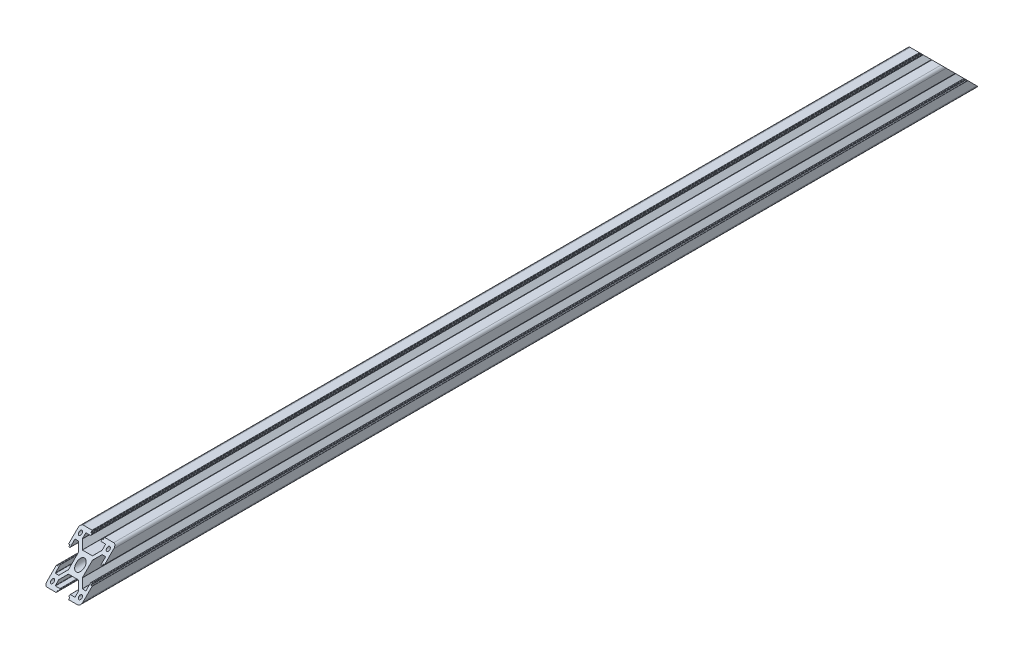
from build123d import *

# Parameters (mm, degrees)
CROQUIS1_R              = 1.25
CROQUIS1_R_2            = 3.4
SALIENTE_EXTRUIR1_DEPTH = 750
CUT_EXTRUDE1_DEPTH      = 751.299940024
CUT_EXTRUDE1_DEPTH_BACK = 751.299940024


with BuildPart() as part:
    # Croquis1 → Saliente-Extruir1 (new body)
    with BuildSketch(Plane.XY):
        with BuildLine():
            Line((-4.161522369, 5.8), (4.161522369, 5.8))
            ThreePointArc((4.161522369, 5.8), (4.238059055, 5.815224093), (4.302943725, 5.858578644))
            Line((4.302943725, 5.858578644), (8.191421356, 9.747056275))
            ThreePointArc((8.191421356, 9.747056275), (8.234775907, 9.811940945), (8.25, 9.888477631))
            Line((8.25, 9.888477631), (8.25, 12.6))
            ThreePointArc((8.25, 12.6), (8.191421356, 12.741421356), (8.05, 12.8))
            Line((8.05, 12.8), (4.3, 12.8))
            ThreePointArc((4.3, 12.8), (4.158578644, 12.858578644), (4.1, 13))
            Line((4.1, 13), (4.1, 13.7))
            ThreePointArc((4.1, 13.7), (4.158578644, 13.841421356), (4.3, 13.9))
            Line((4.3, 13.9), (4.9, 13.9))
            ThreePointArc((4.9, 13.9), (5.041421356, 13.958578644), (5.1, 14.1))
            Line((5.1, 14.1), (5.1, 14.8))
            ThreePointArc((5.1, 14.8), (5.158578644, 14.941421356), (5.3, 15))
            Line((5.3, 15), (12.8, 15))
            ThreePointArc((12.8, 15), (14.355634919, 14.355634919), (15, 12.8))
            Line((15, 12.8), (15, 5.3))
            ThreePointArc((15, 5.3), (14.941421356, 5.158578644), (14.8, 5.1))
            Line((14.8, 5.1), (13.9, 5.1))
            Line((13.9, 5.1), (13.9, 4.3))
            ThreePointArc((13.9, 4.3), (13.841421356, 4.158578644), (13.7, 4.1))
            Line((13.7, 4.1), (13, 4.1))
            ThreePointArc((13, 4.1), (12.858578644, 4.158578644), (12.8, 4.3))
            Line((12.8, 4.3), (12.8, 8.05))
            ThreePointArc((12.8, 8.05), (12.741421356, 8.191421356), (12.6, 8.25))
            Line((12.6, 8.25), (9.888477631, 8.25))
            ThreePointArc((9.888477631, 8.25), (9.811940945, 8.234775907), (9.747056275, 8.191421356))
            Line((9.747056275, 8.191421356), (5.858578644, 4.302943725))
            ThreePointArc((5.858578644, 4.302943725), (5.815224093, 4.238059055), (5.8, 4.161522369))
            Line((5.8, 4.161522369), (5.8, -4.161522369))
            ThreePointArc((5.8, -4.161522369), (5.815224093, -4.238059055), (5.858578644, -4.302943725))
            Line((5.858578644, -4.302943725), (9.747056275, -8.191421356))
            ThreePointArc((9.747056275, -8.191421356), (9.811940945, -8.234775907), (9.888477631, -8.25))
            Line((9.888477631, -8.25), (12.6, -8.25))
            ThreePointArc((12.6, -8.25), (12.741421356, -8.191421356), (12.8, -8.05))
            Line((12.8, -8.05), (12.8, -4.3))
            ThreePointArc((12.8, -4.3), (12.858578644, -4.158578644), (13, -4.1))
            Line((13, -4.1), (13.7, -4.1))
            ThreePointArc((13.7, -4.1), (13.841421356, -4.158578644), (13.9, -4.3))
            Line((13.9, -4.3), (13.9, -5.1))
            Line((13.9, -5.1), (14.8, -5.1))
            ThreePointArc((14.8, -5.1), (14.941421356, -5.158578644), (15, -5.3))
            Line((15, -5.3), (15, -12.8))
            ThreePointArc((15, -12.8), (14.355634919, -14.355634919), (12.8, -15))
            Line((12.8, -15), (5.3, -15))
            ThreePointArc((5.3, -15), (5.158578644, -14.941421356), (5.1, -14.8))
            Line((5.1, -14.8), (5.1, -14.1))
            ThreePointArc((5.1, -14.1), (5.041421356, -13.958578644), (4.9, -13.9))
            Line((4.9, -13.9), (4.3, -13.9))
            ThreePointArc((4.3, -13.9), (4.158578644, -13.841421356), (4.1, -13.7))
            Line((4.1, -13.7), (4.1, -13))
            ThreePointArc((4.1, -13), (4.158578644, -12.858578644), (4.3, -12.8))
            Line((4.3, -12.8), (8.05, -12.8))
            ThreePointArc((8.05, -12.8), (8.191421356, -12.741421356), (8.25, -12.6))
            Line((8.25, -12.6), (8.25, -9.888477631))
            ThreePointArc((8.25, -9.888477631), (8.234775907, -9.811940945), (8.191421356, -9.747056275))
            Line((8.191421356, -9.747056275), (4.302943725, -5.858578644))
            ThreePointArc((4.302943725, -5.858578644), (4.238059055, -5.815224093), (4.161522369, -5.8))
            Line((4.161522369, -5.8), (-4.161522369, -5.8))
            ThreePointArc((-4.161522369, -5.8), (-4.238059055, -5.815224093), (-4.302943725, -5.858578644))
            Line((-4.302943725, -5.858578644), (-8.191421356, -9.747056275))
            ThreePointArc((-8.191421356, -9.747056275), (-8.234775907, -9.811940945), (-8.25, -9.888477631))
            Line((-8.25, -9.888477631), (-8.25, -12.6))
            ThreePointArc((-8.25, -12.6), (-8.191421356, -12.741421356), (-8.05, -12.8))
            Line((-8.05, -12.8), (-4.3, -12.8))
            ThreePointArc((-4.3, -12.8), (-4.158578644, -12.858578644), (-4.1, -13))
            Line((-4.1, -13), (-4.1, -13.7))
            ThreePointArc((-4.1, -13.7), (-4.158578644, -13.841421356), (-4.3, -13.9))
            Line((-4.3, -13.9), (-4.9, -13.9))
            ThreePointArc((-4.9, -13.9), (-5.041421356, -13.958578644), (-5.1, -14.1))
            Line((-5.1, -14.1), (-5.1, -14.8))
            ThreePointArc((-5.1, -14.8), (-5.158578644, -14.941421356), (-5.3, -15))
            Line((-5.3, -15), (-12.8, -15))
            ThreePointArc((-12.8, -15), (-14.355634919, -14.355634919), (-15, -12.8))
            Line((-15, -12.8), (-15, -5.3))
            ThreePointArc((-15, -5.3), (-14.941421356, -5.158578644), (-14.8, -5.1))
            Line((-14.8, -5.1), (-13.9, -5.1))
            Line((-13.9, -5.1), (-13.9, -4.3))
            ThreePointArc((-13.9, -4.3), (-13.841421356, -4.158578644), (-13.7, -4.1))
            Line((-13.7, -4.1), (-13, -4.1))
            ThreePointArc((-13, -4.1), (-12.858578644, -4.158578644), (-12.8, -4.3))
            Line((-12.8, -4.3), (-12.8, -8.05))
            ThreePointArc((-12.8, -8.05), (-12.741421356, -8.191421356), (-12.6, -8.25))
            Line((-12.6, -8.25), (-9.888477631, -8.25))
            ThreePointArc((-9.888477631, -8.25), (-9.811940945, -8.234775907), (-9.747056275, -8.191421356))
            Line((-9.747056275, -8.191421356), (-5.858578644, -4.302943725))
            ThreePointArc((-5.858578644, -4.302943725), (-5.815224093, -4.238059055), (-5.8, -4.161522369))
            Line((-5.8, -4.161522369), (-5.8, 4.161522369))
            ThreePointArc((-5.8, 4.161522369), (-5.815224093, 4.238059055), (-5.858578644, 4.302943725))
            Line((-5.858578644, 4.302943725), (-9.747056275, 8.191421356))
            ThreePointArc((-9.747056275, 8.191421356), (-9.811940945, 8.234775907), (-9.888477631, 8.25))
            Line((-9.888477631, 8.25), (-12.6, 8.25))
            ThreePointArc((-12.6, 8.25), (-12.741421356, 8.191421356), (-12.8, 8.05))
            Line((-12.8, 8.05), (-12.8, 4.3))
            ThreePointArc((-12.8, 4.3), (-12.858578644, 4.158578644), (-13, 4.1))
            Line((-13, 4.1), (-13.7, 4.1))
            ThreePointArc((-13.7, 4.1), (-13.841421356, 4.158578644), (-13.9, 4.3))
            Line((-13.9, 4.3), (-13.9, 5.1))
            Line((-13.9, 5.1), (-14.8, 5.1))
            ThreePointArc((-14.8, 5.1), (-14.941421356, 5.158578644), (-15, 5.3))
            Line((-15, 5.3), (-15, 12.8))
            ThreePointArc((-15, 12.8), (-14.355634919, 14.355634919), (-12.8, 15))
            Line((-12.8, 15), (-5.3, 15))
            ThreePointArc((-5.3, 15), (-5.158578644, 14.941421356), (-5.1, 14.8))
            Line((-5.1, 14.8), (-5.1, 14.1))
            ThreePointArc((-5.1, 14.1), (-5.041421356, 13.958578644), (-4.9, 13.9))
            Line((-4.9, 13.9), (-4.3, 13.9))
            ThreePointArc((-4.3, 13.9), (-4.158578644, 13.841421356), (-4.1, 13.7))
            Line((-4.1, 13.7), (-4.1, 13))
            ThreePointArc((-4.1, 13), (-4.158578644, 12.858578644), (-4.3, 12.8))
            Line((-4.3, 12.8), (-8.05, 12.8))
            ThreePointArc((-8.05, 12.8), (-8.191421356, 12.741421356), (-8.25, 12.6))
            Line((-8.25, 12.6), (-8.25, 9.888477631))
            ThreePointArc((-8.25, 9.888477631), (-8.234775907, 9.811940945), (-8.191421356, 9.747056275))
            Line((-8.191421356, 9.747056275), (-4.302943725, 5.858578644))
            ThreePointArc((-4.302943725, 5.858578644), (-4.238059055, 5.815224093), (-4.161522369, 5.8))
        make_face()
        with Locations((11.625, 11.625)):
            Circle(CROQUIS1_R, mode=Mode.SUBTRACT)
        with Locations((11.625, -11.625)):
            Circle(CROQUIS1_R, mode=Mode.SUBTRACT)
        with Locations((-11.625, -11.625)):
            Circle(CROQUIS1_R, mode=Mode.SUBTRACT)
        with Locations((-11.625, 11.625)):
            Circle(CROQUIS1_R, mode=Mode.SUBTRACT)
        Circle(CROQUIS1_R_2, mode=Mode.SUBTRACT)
    extrude(amount=SALIENTE_EXTRUIR1_DEPTH)

    # Sketch1 → Cut-Extrude1 (cut, two sides: drawn at the far end of the back side and taken through both)
    with BuildSketch(Plane(origin=(0, 0, 0), x_dir=(0, 0, -1), z_dir=(1, 0, 0)).offset(-CUT_EXTRUDE1_DEPTH_BACK)):
        Polygon((-750, -15), (-720, 15), (-750, 15), align=None)
        Polygon((0, 15), (0, -15), (-30, 15), align=None)
    extrude(amount=CUT_EXTRUDE1_DEPTH + CUT_EXTRUDE1_DEPTH_BACK, mode=Mode.SUBTRACT)


solid = part.part
